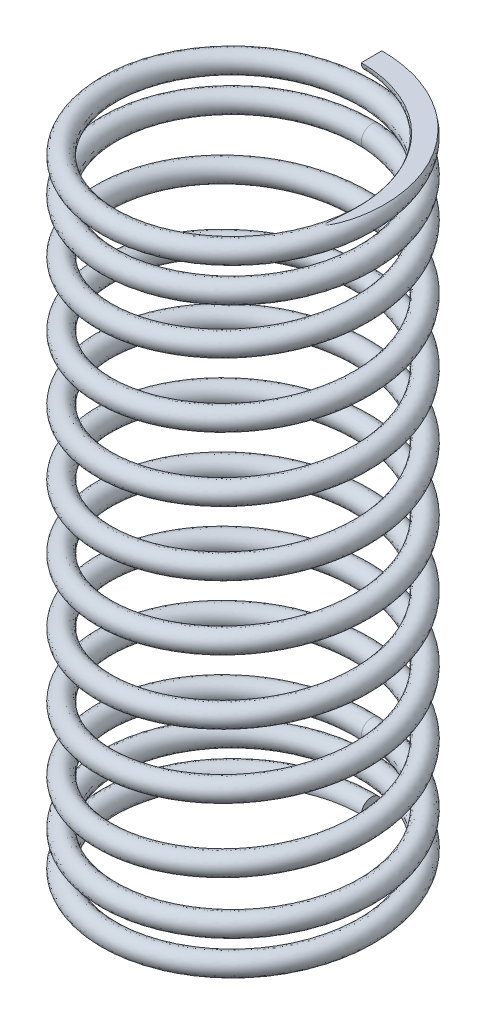
from build123d import *

# Parameters (mm, degrees)
SWEEP1_PITCH            = 2.38125
SWEEP1_HEIGHT           = 19.05
SWEEP1_RADIUS           = 4.7625
SWEEP1_START_ANGLE      = -180
SKETCH2_R               = 0.381
SWEEP2_PITCH            = 1.27
SWEEP2_HEIGHT           = 2.54
SWEEP2_RADIUS           = 4.7625
SKETCH4_R               = 0.381
SWEEP3_PITCH            = 1.27
SWEEP3_HEIGHT           = 2.54
SWEEP3_RADIUS           = 4.7625
SWEEP3_START_ANGLE      = -180
SKETCH7_R               = 0.381
CUT_EXTRUDE1_DEPTH      = 24.143811891
CUT_EXTRUDE1_DEPTH_BACK = 24.143811891
CUT_EXTRUDE2_DEPTH      = 24.143811891
CUT_EXTRUDE2_DEPTH_BACK = 24.143811891


with BuildPart() as part:
    # Sweep1: sweep along a helix
    with BuildLine() as sweep1_path:
        add(Helix(SWEEP1_PITCH, SWEEP1_HEIGHT, SWEEP1_RADIUS, center=(0, 0, 0), direction=(0, 1, 0), mode=Mode.PRIVATE).rotate(Axis((0, 0, 0), (0, 1, 0)), SWEEP1_START_ANGLE))
    # Sketch2 → Sweep1 (sweep)
    with BuildSketch(Plane(origin=(0, 0, 0), x_dir=(0, 0, -1), z_dir=(1, 0, 0))):
        with Locations((4.7625, 0)):
            Circle(SKETCH2_R)
    sweep(path=sweep1_path.line, is_frenet=True)

    # Sweep2: sweep along a helix
    with BuildLine() as sweep2_path:
        Helix(SWEEP2_PITCH, SWEEP2_HEIGHT, SWEEP2_RADIUS, center=(0, 0, 0), direction=(0, -1, 0))
    # Sketch4 → Sweep2 (sweep)
    with BuildSketch(Plane(origin=(0, 0, 0), x_dir=(0, 0, -1), z_dir=(1, 0, 0))):
        with Locations((4.7625, 0)):
            Circle(SKETCH4_R)
    sweep(path=sweep2_path.line, is_frenet=True)

    # Sweep3: sweep along a helix
    with BuildLine() as sweep3_path:
        add(Helix(SWEEP3_PITCH, SWEEP3_HEIGHT, SWEEP3_RADIUS, center=(0, 19.05, 0), direction=(0, 1, 0), mode=Mode.PRIVATE).rotate(Axis((0, 19.05, 0), (0, 1, 0)), SWEEP3_START_ANGLE))
    # Sketch7 → Sweep3 (sweep)
    with BuildSketch(Plane.ZY):
        with Locations((-4.7625, 19.05)):
            Circle(SKETCH7_R)
    sweep(path=sweep3_path.line, is_frenet=True)

    # Sketch8 → Cut-Extrude1 (cut, two sides: drawn at the far end of the back side and taken through both)
    with BuildSketch(Plane(origin=(0, 0, 0), x_dir=(0, 0, -1), z_dir=(1, 0, 0)).offset(-CUT_EXTRUDE1_DEPTH_BACK)):
        Polygon((70.493870214, 21.59), (6.35, 21.59), (-6.35, 21.59), (-70.493870214, 21.59), (-70.493870214, 149.877740429), (70.493870214, 149.877740429), align=None)
    extrude(amount=CUT_EXTRUDE1_DEPTH + CUT_EXTRUDE1_DEPTH_BACK, mode=Mode.SUBTRACT)

    # Sketch10 → Cut-Extrude2 (cut, two sides: drawn at the far end of the back side and taken through both)
    with BuildSketch(Plane(origin=(0, 0, 0), x_dir=(0, 0, -1), z_dir=(1, 0, 0)).offset(-CUT_EXTRUDE2_DEPTH_BACK)):
        Polygon((70.493870214, -2.54), (6.35, -2.54), (-6.35, -2.54), (-70.493870214, -2.54), (-70.493870214, -130.827740429), (70.493870214, -130.827740429), align=None)
    extrude(amount=CUT_EXTRUDE2_DEPTH + CUT_EXTRUDE2_DEPTH_BACK, mode=Mode.SUBTRACT)


solid = part.part
